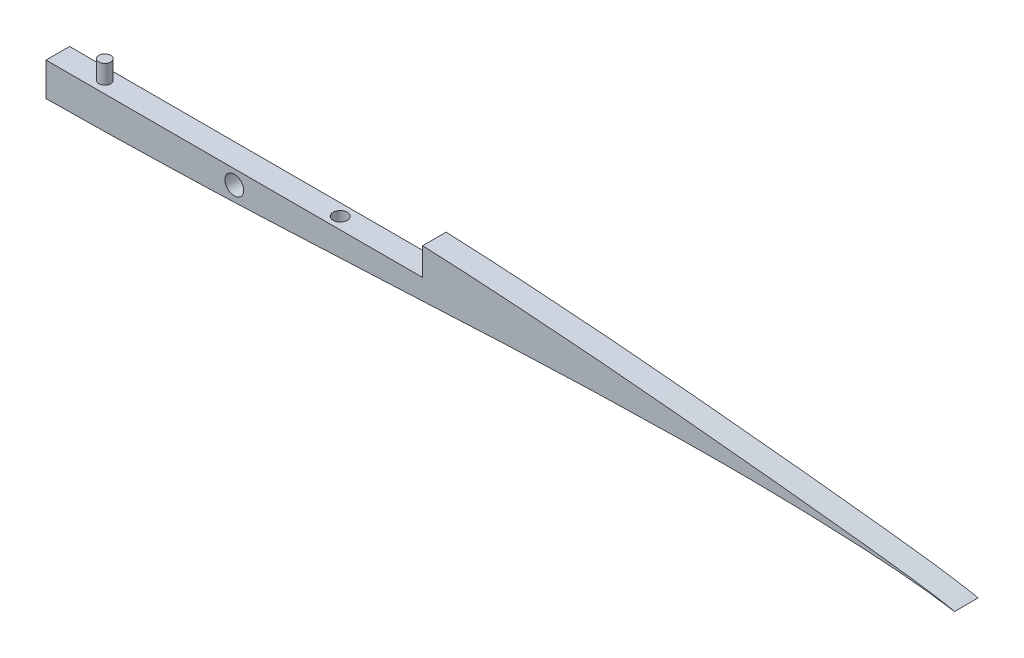
from build123d import *

# Parameters (mm, degrees)
STOCK_BASE_START            = -6.35
STOCK_BASE_RIB_BODY_1_DEPTH = 6.35
BOSS_EXTRUDE1_DEPTH         = 5.08
CUT_EXTRUDE1_DEPTH          = 5.08
SKETCH2_R                   = 2.54
CUT_EXTRUDE2_DEPTH          = 306.702054727


# Read off the part's stored shape, not the designer's step: Stock-Base rib body-1
with BuildPart() as part:
    # Stock-Base rib body-1 outline → Stock-Base rib body-1 (new body)
    with BuildSketch(Plane.XY.offset(STOCK_BASE_START)):
        with BuildLine():
            Line((161.289999981, 22.571350716), (161.29, 15.150340758))
            Line((161.29, 15.150340758), (59.69, 15.150340758))
            Line((59.69, 15.150340758), (59.69, 6.134698498))
            add(Edge.make_bspline(
                [(59.69, 6.134698498), (62.370101804, 6.160023518), (67.877452262, 6.182447157), (76.307956217, 6.373158096), (85.09907939, 6.509442243), (94.162943379, 6.79146182), (103.491777789, 7.043168657), (113.013413145, 7.422019176), (122.717663004, 7.796869995), (132.538395015, 8.249196415), (142.452771402, 8.707918686), (152.399232196, 9.217154004), (162.351098417, 9.713525096), (172.257801894, 10.203694877), (182.087133464, 10.637497333), (191.780226111, 11.062313384), (201.314005616, 11.398588689), (210.630363502, 11.71219288), (219.704890932, 11.928662407), (228.487751662, 12.105474427), (236.947100219, 12.195438631), (245.043170333, 12.229158657), (252.742806253, 12.181946241), (260.013825454, 12.064770152), (266.8235427, 11.878977654), (273.14344318, 11.644203577), (278.944519004, 11.361273095), (284.206358459, 11.050038473), (288.903664519, 10.712343504), (293.017371724, 10.353180028), (296.521945453, 9.997313173), (299.426457428, 9.637189525), (301.630485972, 9.338036313), (303.370853204, 9.064651021), (304.119516082, 8.951899031), (304.782946498, 8.835953449), (304.8, 8.840705219), (304.82012511, 8.84631286), (304.136800475, 9.039024801), (303.375322868, 9.156226676), (301.636958583, 9.507509775), (299.426767543, 9.869463422), (296.518953252, 10.328013797), (293.018467792, 10.824800612), (288.900536795, 11.360444608), (284.204885436, 11.935014904), (278.940836996, 12.542405848), (273.143680748, 13.196668182), (266.817821912, 13.87258495), (260.019791182, 14.607535084), (252.741163128, 15.343048003), (245.055559941, 16.131641074), (236.946583275, 16.900491852), (228.508068346, 17.731071309), (219.707729735, 18.508351891), (210.662190304, 19.341207583), (201.320827802, 20.063479603), (191.814362749, 20.822556875), (182.095576055, 21.436953514), (172.287559077, 22.067269015), (165.318927668, 22.384131376), (161.648984481, 22.55467852), (161.289999981, 22.571350716)],
                knots=[0.608211552, 0.608211552, 0.608211552, 0.608211552, 0.620979222, 0.634441734, 0.648424207, 0.662880137, 0.677739163, 0.692957281, 0.708452453, 0.724176515, 0.740041984, 0.755990469, 0.771938353, 0.787811294, 0.803535896, 0.819040498, 0.834255058, 0.849121195, 0.863570137, 0.877552378, 0.891006016, 0.903874255, 0.916114356, 0.927680384, 0.938530909, 0.948621564, 0.957908587, 0.966363629, 0.97395265, 0.980639895, 0.986402983, 0.99120656, 0.995011197, 0.997773026, 0.999447193, 1, 1, 1, 1.000652376, 1.002403448, 1.005256568, 1.009165764, 1.014096751, 1.020022012, 1.026896344, 1.034706383, 1.043414458, 1.05299002, 1.063396809, 1.074601254, 1.08653103, 1.0991543, 1.112392946, 1.126224492, 1.140544889, 1.155318673, 1.170431652, 1.185859272, 1.201486855, 1.217293377, 1.233167489, 1.234888603, 1.234888603, 1.234888603, 1.234888603], degree=3))
        make_face()
    extrude(amount=STOCK_BASE_RIB_BODY_1_DEPTH)

    # Sketch1 → Boss-Extrude1 (add)
    with BuildSketch(Plane(origin=(0, 15.150340758, 0), x_dir=(1, 0, 0), z_dir=(0, 1, 0))):
        with BuildLine():
            ThreePointArc((70.8025, 3.175), (72.39, 1.5875), (73.9775, 3.175))
            Line((73.9775, 3.175), (70.8025, 3.175))
        make_face()
        with BuildLine():
            Line((70.8025, 3.175), (73.9775, 3.175))
            ThreePointArc((73.9775, 3.175), (72.39, 4.7625), (70.8025, 3.175))
        make_face()
    extrude(amount=BOSS_EXTRUDE1_DEPTH)

    # Sketch1<3> → Cut-Extrude1 (cut)
    with BuildSketch(Plane(origin=(0, 15.150340758, 0), x_dir=(1, 0, 0), z_dir=(0, 1, 0))):
        with BuildLine():
            ThreePointArc((133.985, 3.175), (135.89, 1.27), (137.795, 3.175))
            Line((137.795, 3.175), (133.985, 3.175))
        make_face()
        with BuildLine():
            Line((133.985, 3.175), (137.795, 3.175))
            ThreePointArc((137.795, 3.175), (135.89, 5.08), (133.985, 3.175))
        make_face()
    extrude(amount=-CUT_EXTRUDE1_DEPTH, mode=Mode.SUBTRACT)

    # Sketch2 → Cut-Extrude2 (cut, through all)
    with BuildSketch(Plane.XY):
        with Locations((110.49, 11.340340758)):
            Circle(SKETCH2_R)
    extrude(amount=-CUT_EXTRUDE2_DEPTH, mode=Mode.SUBTRACT)


solid = part.part
